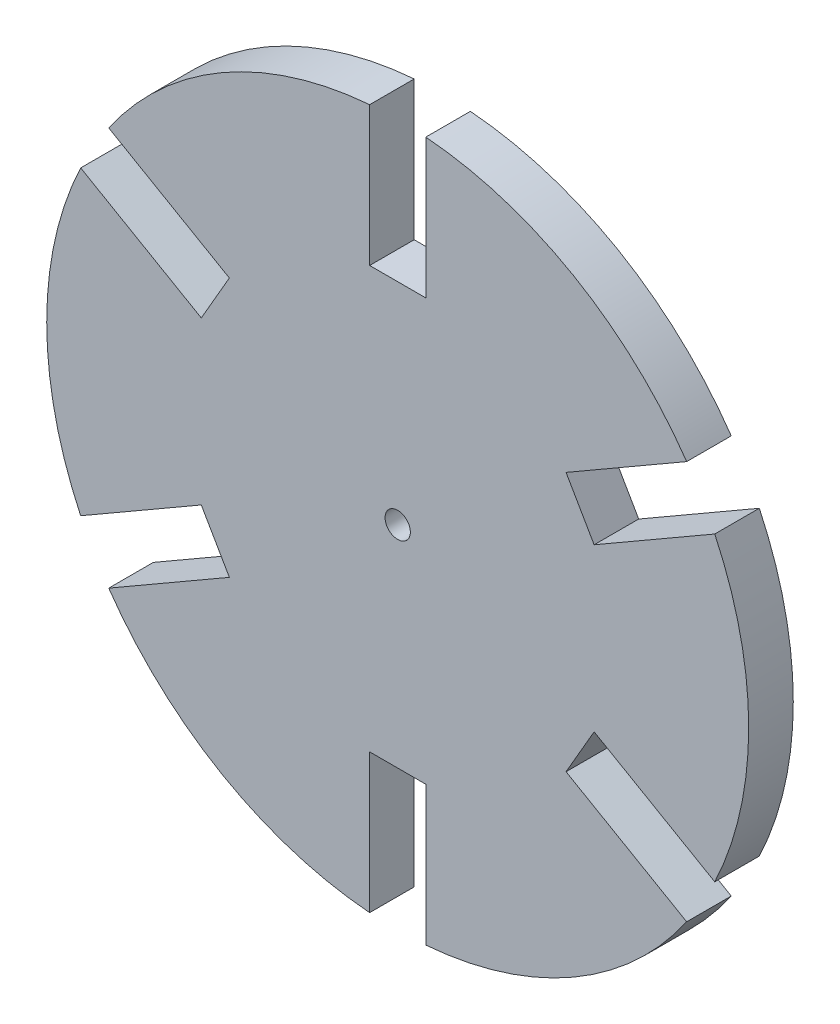
from build123d import *

# Parameters (mm, degrees)
SKETCH1_R           = 25
SKETCH1_R_2         = 0.9
BOSS_EXTRUDE1_DEPTH = 1.5875
CUT_EXTRUDE1_REACH  = 37.498
SKETCH2_W           = 4
SKETCH2_H           = 19.044786736
CIRPATTERN1_COUNT   = 6


with BuildPart() as part:
    # Sketch1 → Boss-Extrude1 (new, symmetric)
    with BuildSketch(Plane.XY):
        Circle(SKETCH1_R)
        Circle(SKETCH1_R_2, mode=Mode.SUBTRACT)
    extrude(amount=BOSS_EXTRUDE1_DEPTH, both=True)

    # Sketch2 → Cut-Extrude1 (cut, up to next)
    with BuildSketch(Plane(origin=(0, 0, -1.5875), x_dir=(-1, 0, 0), z_dir=(0, 0, -1)), mode=Mode.PRIVATE) as cut_extrude1_sk1:
        with Locations((0, 24.522393368)):
            Rectangle(SKETCH2_W, SKETCH2_H)
    cut_extrude1_tool1 = extrude(cut_extrude1_sk1.sketch, amount=-CUT_EXTRUDE1_REACH, mode=Mode.PRIVATE) & part.part
    cut_extrude1 = cut_extrude1_tool1.solids().sort_by_distance((0, 24.522393, -1.5875))[0]
    add(cut_extrude1, mode=Mode.SUBTRACT)

    # CirPattern1: Cut-Extrude1 ×6 about axis
    cirpattern1_axis = Axis((0, 0, 1.5875), (0, 0, 1))
    for i in range(1, CIRPATTERN1_COUNT):
        add(cut_extrude1.rotate(cirpattern1_axis, i * 360 / CIRPATTERN1_COUNT), mode=Mode.SUBTRACT)


solid = part.part
